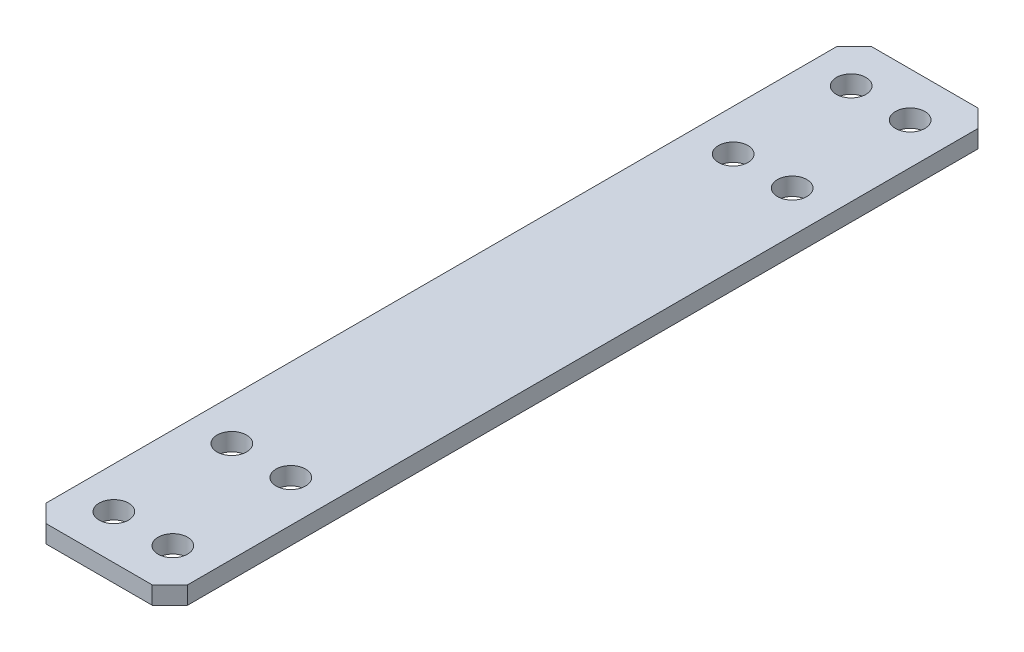
from build123d import *

# Parameters (mm, degrees)
SKETCH_1_W            = 24
SKETCH_1_H            = 140
EXTRUDE_1_DEPTH       = 3
HOLE_WIZARD_5_0_5_1_D = 5
CHAMFER_1_SIZE        = 3


with BuildPart() as part:
    # 草圖1 → 填料-伸長1 (new body)
    with BuildSketch(Plane(origin=(0, 0, 0), x_dir=(1, 0, 0), z_dir=(0, 1, 0))):
        Rectangle(SKETCH_1_W, SKETCH_1_H)
    extrude(amount=EXTRUDE_1_DEPTH)

    # Ø5.0 (5) 直徑孔1 (through all)
    with Locations(Plane(origin=(-5, 3, -62.5), x_dir=(0, 0, 1), z_dir=(0, 1, 0))):
        with Locations((0, 0), (0, 10), (20, 10), (20, 0), (105, 10), (105, 0), (125, 10), (125, 0)):
            Hole(HOLE_WIZARD_5_0_5_1_D / 2)

    # 導角1
    chamfer_1_edges = [part.edges().sort_by_distance(p)[0] for p in [
        (-12, 1.5, 70),
        (12, 1.5, 70),
        (12, 1.5, -70),
        (-12, 1.5, -70),
    ]]
    chamfer(chamfer_1_edges, length=CHAMFER_1_SIZE)


solid = part.part
